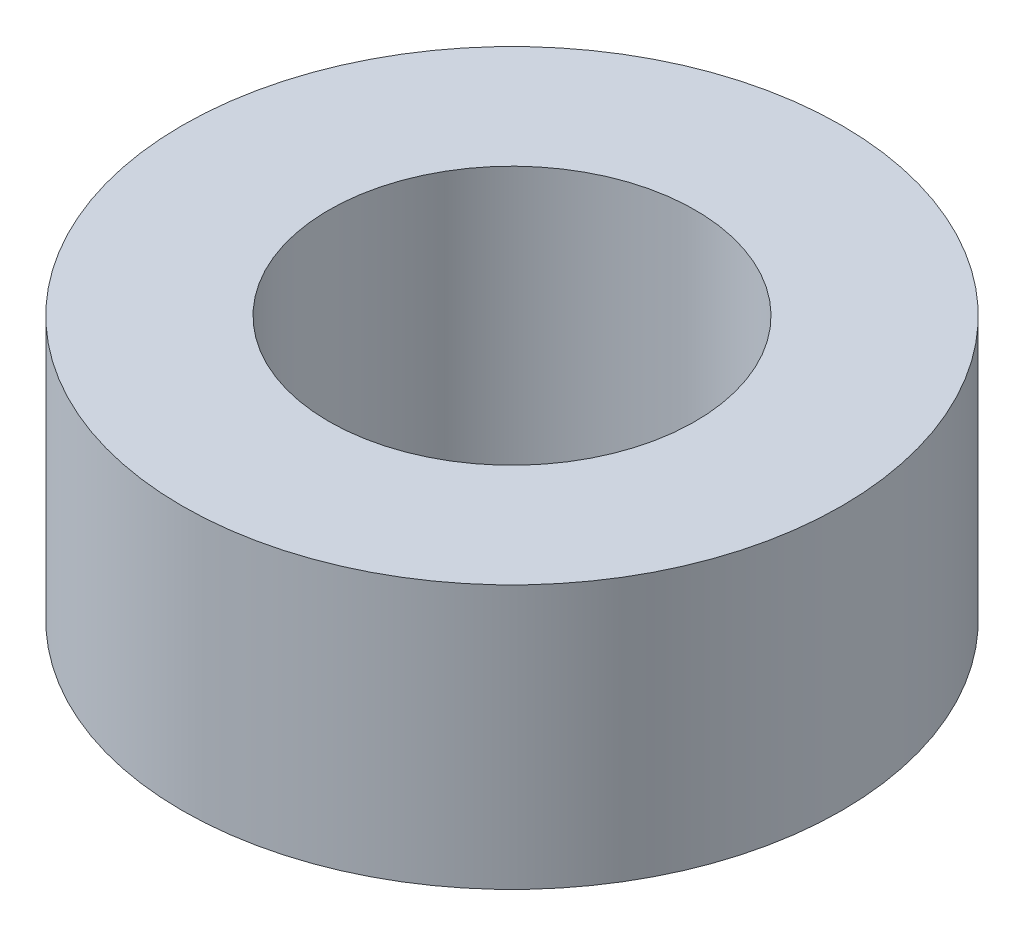
from build123d import *

# Parameters (mm, degrees)
SKETCH1_R           = 22.5
BOSS_EXTRUDE1_DEPTH = 18
SKETCH2_R           = 12.5
CUT_EXTRUDE1_DEPTH  = 37.558172821


with BuildPart() as part:
    # Sketch1 → Boss-Extrude1 (new body)
    with BuildSketch(Plane(origin=(0, 0, 0), x_dir=(1, 0, 0), z_dir=(0, 1, 0))):
        Circle(SKETCH1_R)
    extrude(amount=BOSS_EXTRUDE1_DEPTH)

    # Sketch2 → Cut-Extrude1 (cut, through all)
    with BuildSketch(Plane(origin=(0, 0, 0), x_dir=(1, 0, 0), z_dir=(0, 1, 0))):
        Circle(SKETCH2_R)
    extrude(amount=CUT_EXTRUDE1_DEPTH, mode=Mode.SUBTRACT)


solid = part.part
